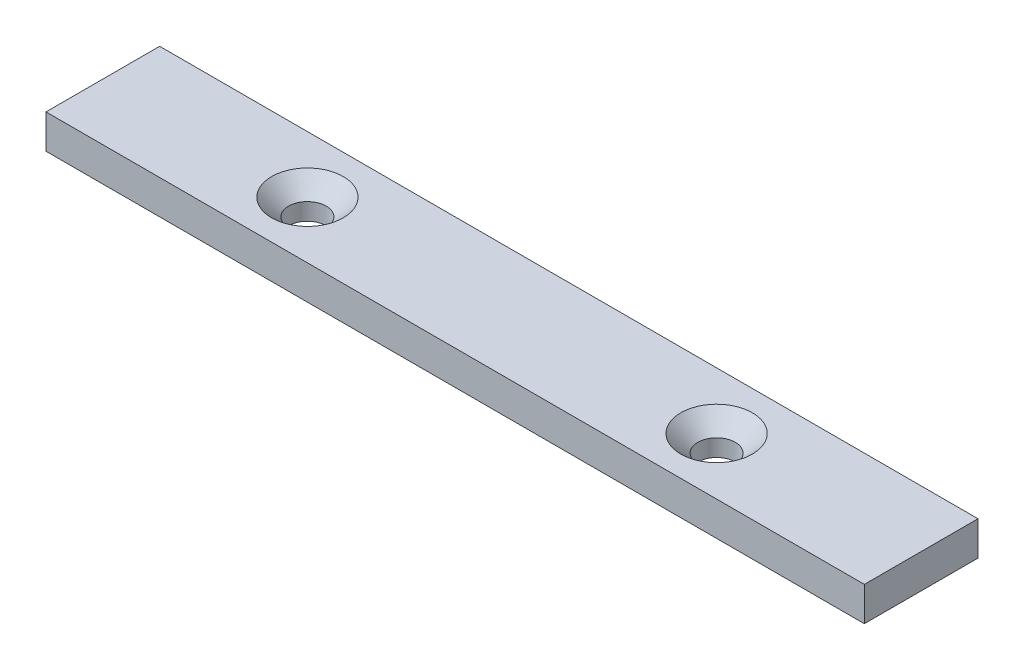
from build123d import *

# Parameters (mm, degrees)
IZIM1_W                     = 144
IZIM1_H                     = 20
Y_KSEKLIK_EKSTR_ZYON1_DEPTH = 6


# Read off the part's stored shape, not the designer's step: Delik1
with BuildPart() as part:
    # Çizim1 → Yükseklik-Ekstrüzyon1 (new body)
    with BuildSketch(Plane(origin=(0, 0, 0), x_dir=(1, 0, 0), z_dir=(0, 1, 0))):
        with Locations((-1.811890532, -27.92513369)):
            Rectangle(IZIM1_W, IZIM1_H)
    extrude(amount=Y_KSEKLIK_EKSTR_ZYON1_DEPTH)

    # Delik1 outline → Delik1 (revolve, cut)
    with BuildSketch(Plane(origin=(34.188109468, 0, 27.92513369), x_dir=(1, 0, 0), z_dir=(0, 0, 1))):
        Polygon((0, 0), (3.3, 0), (3.3, 3), (6.3, 6), (0, 6), align=None)
    revolve(axis=Axis((34.188109468, 0, 27.92513369), (0, 1, 0)), mode=Mode.SUBTRACT)

    # Delik1 2 outline → Delik1 2 (revolve, cut)
    with BuildSketch(Plane(origin=(-37.811890532, 0, 27.92513369), x_dir=(1, 0, 0), z_dir=(0, 0, 1))):
        Polygon((0, 0), (3.3, 0), (3.3, 3), (6.3, 6), (0, 6), align=None)
    revolve(axis=Axis((-37.811890532, 0, 27.92513369), (0, 1, 0)), mode=Mode.SUBTRACT)


solid = part.part
